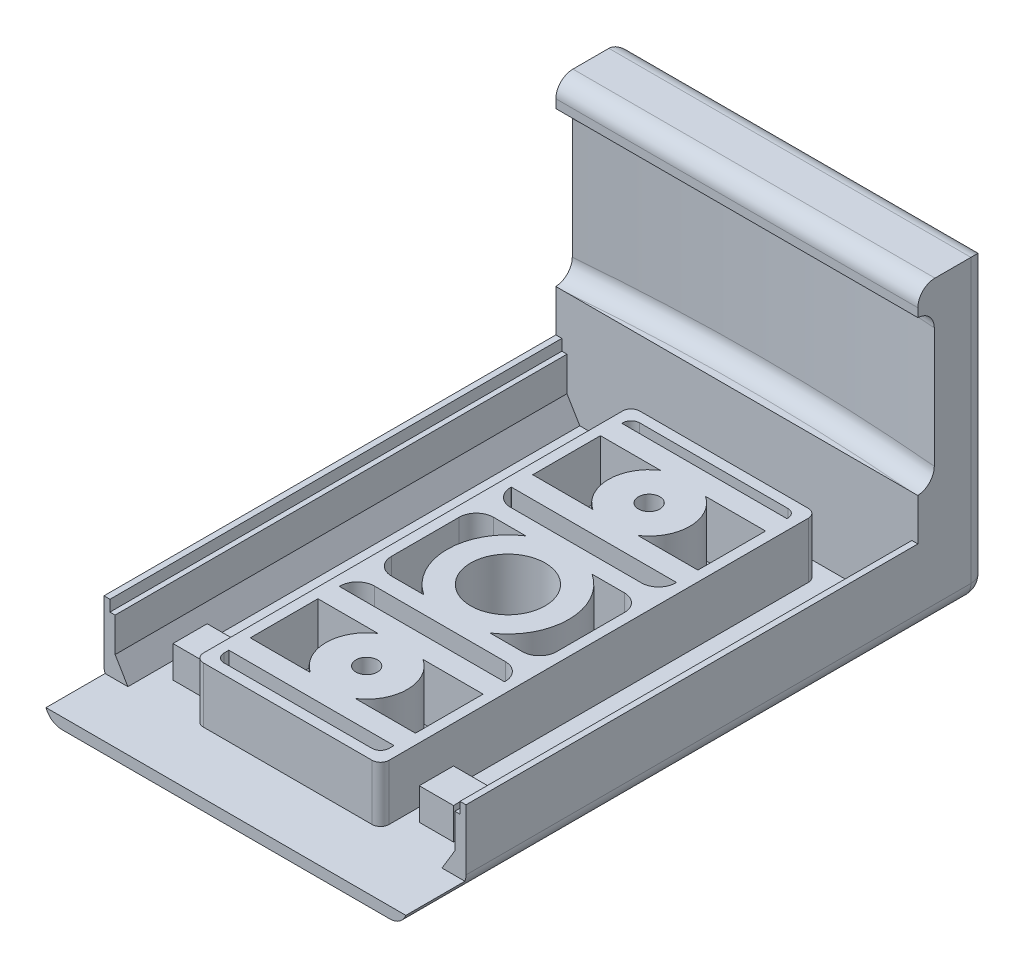
from build123d import *

# Parameters (mm, degrees)
SALIENTE_EXTRUIR1_DEPTH  = 42.3
CROQUIS3_W               = 40.9
CROQUIS3_H               = 56.9
CORTAR_EXTRUIR1_DEPTH    = 1.3
CROQUIS5_W               = 42.3
CROQUIS5_H               = 2.8
CORTAR_EXTRUIR2_DEPTH    = 7.8
CROQUIS6_W               = 40.9
CROQUIS6_H               = 26.5
CORTAR_EXTRUIR3_DEPTH    = 1.3
CROQUIS8_W               = 39.7
CROQUIS8_H               = 56.9
CORTAR_EXTRUIR4_DEPTH    = 6.5
CROQUIS9_W               = 39.7
CROQUIS9_H               = 32.2
CORTAR_EXTRUIR5_DEPTH    = 7.3
CROQUIS10_W              = 21.7
CROQUIS10_H              = 50.979199381
CROQUIS10_W_2            = 19.3
CROQUIS10_H_2            = 48.579199381
SALIENTE_EXTRUIR2_DEPTH  = 6.5
REDONDEO6_R              = 1
REDONDEO7_R              = 1
CROQUIS17_W              = 39.7
CROQUIS17_H              = 32.2
SALIENTE_EXTRUIR4_DEPTH  = 6
SALIENTE_EXTRUIR5_DEPTH  = 1.3
CORTAR_EXTRUIR6_DEPTH    = 21
REDONDEO8_R              = 2
REDONDEO10_R             = 2
CROQUIS26_R              = 7.1
CROQUIS26_R_2            = 4.35
SALIENTE_EXTRUIR7_DEPTH  = 6.5
CORTAR_EXTRUIR7_START    = -44
CROQUIS27_R              = 4.35
CORTAR_EXTRUIR7_DEPTH    = 44
CROQUIS28_W              = 19.3
CROQUIS28_H              = 2
SALIENTE_EXTRUIR8_DEPTH  = 6.5
REDONDEO11_R             = 2
REDONDEO12_R             = 2
CROQUIS30_R              = 4.75
CROQUIS30_R_2            = 1.25
SALIENTE_EXTRUIR9_DEPTH  = 6.5
CROQUIS33_W              = 19.3
CROQUIS33_H              = 2.5
SALIENTE_EXTRUIR11_DEPTH = 6.5
CORTAR_EXTRUIR8_DEPTH    = 4.1
CROQUIS23_W              = 4
CROQUIS23_H              = 4
SALIENTE_EXTRUIR12_DEPTH = 3.7
NERVIO5_REACH            = 61.555
CROQUIS39_WALL_W         = 124.026264302
CROQUIS39_WALL_H         = 52.8
NERVIO7_REACH            = 61.555
CROQUIS43_WALL_W         = 124.026264302
CROQUIS43_WALL_H         = 52.8
CROQUIS44_W              = 42.3
CROQUIS44_H              = 3
SALIENTE_EXTRUIR13_DEPTH = 4.7
REDONDEO13_R             = 2
REDONDEO14_R             = 2


with BuildPart() as part:
    # Croquis1 → Saliente-Extruir1 (new body)
    with BuildSketch(Plane(origin=(0, 0, 0), x_dir=(0, 0, -1), z_dir=(1, 0, 0))):
        Polygon((-38.13826087, -2.227336957), (21.56173913, -2.227336957), (21.56173913, 23.672663043), (29.76173913, 23.672663043), (29.76173913, -2.261684783), (29.76173913, -11.327336957), (-38.13826087, -11.327336957), align=None)
    extrude(amount=-SALIENTE_EXTRUIR1_DEPTH)

    # Croquis3 → Cortar-Extruir1 (cut)
    with BuildSketch(Plane(origin=(0, -2.227336957, 0), x_dir=(1, 0, 0), z_dir=(0, 1, 0))):
        with Locations((-21.15, -6.88826087)):
            Rectangle(CROQUIS3_W, CROQUIS3_H)
    extrude(amount=-CORTAR_EXTRUIR1_DEPTH, mode=Mode.SUBTRACT)

    # Croquis5 → Cortar-Extruir2 (cut)
    with BuildSketch(Plane(origin=(0, -2.227336957, 0), x_dir=(1, 0, 0), z_dir=(0, 1, 0))):
        with Locations((-21.15, -36.73826087)):
            Rectangle(CROQUIS5_W, CROQUIS5_H)
    extrude(amount=-CORTAR_EXTRUIR2_DEPTH, mode=Mode.SUBTRACT)

    # Croquis6 → Cortar-Extruir3 (cut)
    with BuildSketch(Plane.XY.offset(-21.56173913)):
        with Locations((-21.15, 9.722663043)):
            Rectangle(CROQUIS6_W, CROQUIS6_H)
    extrude(amount=-CORTAR_EXTRUIR3_DEPTH, mode=Mode.SUBTRACT)

    # Croquis8 → Cortar-Extruir4 (cut)
    with BuildSketch(Plane(origin=(0, -3.527336957, 0), x_dir=(1, 0, 0), z_dir=(0, 1, 0))):
        with Locations((-21.15, -6.88826087)):
            Rectangle(CROQUIS8_W, CROQUIS8_H)
    extrude(amount=-CORTAR_EXTRUIR4_DEPTH, mode=Mode.SUBTRACT)

    # Croquis9 → Cortar-Extruir5 (cut)
    with BuildSketch(Plane.XY.offset(-21.56173913)):
        with Locations((-21.15, 6.072663043)):
            Rectangle(CROQUIS9_W, CROQUIS9_H)
    extrude(amount=-CORTAR_EXTRUIR5_DEPTH, mode=Mode.SUBTRACT)

    # Croquis10 → Saliente-Extruir2 (add)
    with BuildSketch(Plane(origin=(0, -10.027336957, 0), x_dir=(1, 0, 0), z_dir=(0, 1, 0))):
        with Locations((-21.15, -5.42786056)):
            Rectangle(CROQUIS10_W, CROQUIS10_H)
        with Locations((-21.15, -5.427860561)):
            Rectangle(CROQUIS10_W_2, CROQUIS10_H_2, mode=Mode.SUBTRACT)
    extrude(amount=SALIENTE_EXTRUIR2_DEPTH)

    # Redondeo6
    redondeo6_edges = [part.edges().sort_by_distance(p)[0] for p in [
        (-30.8, -6.777336957, -18.86173913),
        (-11.5, -6.777336957, -18.86173913),
        (-11.5, -6.777336957, 29.717460251),
        (-30.8, -6.777336957, 29.717460251),
    ]]
    fillet(redondeo6_edges, radius=REDONDEO6_R)

    # Redondeo7
    redondeo7_edges = [part.edges().sort_by_distance(p)[0] for p in [
        (-10.3, -6.777336957, -20.06173913),
        (-10.3, -6.777336957, 30.917460251),
        (-32, -6.777336957, 30.917460251),
        (-32, -6.777336957, -20.06173913),
    ]]
    fillet(redondeo7_edges, radius=REDONDEO7_R)

    # Croquis17 → Saliente-Extruir4 (add)
    with BuildSketch(Plane.XY.offset(-28.86173913)):
        with Locations((-21.15, 6.072663043)):
            Rectangle(CROQUIS17_W, CROQUIS17_H)
    extrude(amount=SALIENTE_EXTRUIR4_DEPTH)

    # Croquis18 → Saliente-Extruir5 (add)
    with BuildSketch(Plane.XY.offset(-22.86173913)):
        Polygon((-41.6, 22.972663043), (-41.6, -3.527336957), (-41, -3.527336957), (-41, -10.027336957), (-1.3, -10.027336957), (-1.3, -3.527336957), (-0.7, -3.527336957), (-0.7, 22.972663043), align=None)
    extrude(amount=SALIENTE_EXTRUIR5_DEPTH)

    # Croquis19 → Cortar-Extruir6 (cut)
    with BuildSketch(Plane(origin=(0, 23.672663043, 0), x_dir=(1, 0, 0), z_dir=(0, 1, 0))):
        with BuildLine():
            Line((-42.3, 23.48173913), (-42.3, 21.56173913))
            Line((-42.3, 21.56173913), (0, 21.56173913))
            Line((0, 21.56173913), (0, 23.48173913))
            ThreePointArc((0, 23.48173913), (-21.15, 24.415477395), (-42.3, 23.48173913))
        make_face()
    extrude(amount=-CORTAR_EXTRUIR6_DEPTH, mode=Mode.SUBTRACT)

    # Redondeo8
    redondeo8_edges = [part.edges().sort_by_distance(p)[0] for p in [
        (-42.3, 6.172663043, -29.76173913),
        (-21.15, 23.672663043, -29.76173913),
        (-21.15, -11.327336957, -29.76173913),
        (0, 6.172663043, -29.76173913),
    ]]
    fillet(redondeo8_edges, radius=REDONDEO8_R)

    # Redondeo10
    # the kernel refuses this fillet: 2 mm, written as the material it takes off along each edge
    with BuildSketch(Plane(origin=(-40.3, -9.327336957, -27.76173913), x_dir=(-1, 0, 0), z_dir=(0, -1, 0))) as redondeo10_piece_1_section:
        Polygon((0, 0), (REDONDEO10_R, 0), (REDONDEO10_R, REDONDEO10_R), (0, REDONDEO10_R), align=None)
    redondeo10_piece_1 = extrude(amount=REDONDEO10_R, mode=Mode.PRIVATE)
    redondeo10_piece_1 = redondeo10_piece_1 - Plane(origin=(-40.3, -9.327336957, -27.76173913), x_dir=(0.7071067811865475, 0, 0.7071067811865475), z_dir=(0, -1, 0)) * Sphere(REDONDEO10_R, mode=Mode.PRIVATE)
    add(redondeo10_piece_1, mode=Mode.SUBTRACT)
    with BuildSketch(Plane(origin=(-2, -9.327336957, -27.76173913), x_dir=(0, -1, 0), z_dir=(1, 0, 0))) as redondeo10_piece_2_section:
        Polygon((0, 0), (REDONDEO10_R, 0), (REDONDEO10_R, REDONDEO10_R), (0, REDONDEO10_R), align=None)
    redondeo10_piece_2 = extrude(amount=REDONDEO10_R, mode=Mode.PRIVATE)
    redondeo10_piece_2 = redondeo10_piece_2 - Plane(origin=(-2, -9.327336957, -27.76173913), x_dir=(0, 0.7071067811865475, 0.7071067811865475), z_dir=(1, 0, 0)) * Sphere(REDONDEO10_R, mode=Mode.PRIVATE)
    add(redondeo10_piece_2, mode=Mode.SUBTRACT)
    with BuildSketch(Plane(origin=(-42.3, -11.327336957, -27.76173913), x_dir=(1, 0, 0), z_dir=(0, 0, 1)), Plane(origin=(0, -11.327336957, -27.76173913), x_dir=(0, 1, 0), z_dir=(0, 0, 1))) as redondeo10_piece_3:
        with BuildLine():
            CenterArc((REDONDEO10_R, REDONDEO10_R), REDONDEO10_R, 180, 90)
            Line((0, REDONDEO10_R), (0, 0))
            Line((0, 0), (REDONDEO10_R, 0))
        make_face()
    extrude(amount=70.9, mode=Mode.SUBTRACT)

    # Croquis26 → Saliente-Extruir7 (add)
    with BuildSketch(Plane(origin=(0, -10.027336957, 0), x_dir=(1, 0, 0), z_dir=(0, 1, 0))):
        with Locations(Location((-21.15, -5.18826087, 0), (0, 0, 90))):
            Circle(CROQUIS26_R)
        with Locations(Location((-21.15, -5.18826087, 0), (0, 0, 270))):
            Circle(CROQUIS26_R_2, mode=Mode.SUBTRACT)
    extrude(amount=SALIENTE_EXTRUIR7_DEPTH)

    # Croquis27 → Cortar-Extruir7 (cut)
    with BuildSketch(Plane(origin=(0, -10.027336957, 0), x_dir=(1, 0, 0), z_dir=(0, 1, 0)).offset(CORTAR_EXTRUIR7_START)):
        with Locations(Location((-21.15, -5.18826087, 0), (0, 0, 90))):
            Circle(CROQUIS27_R)
    extrude(amount=CORTAR_EXTRUIR7_DEPTH, mode=Mode.SUBTRACT)

    # Croquis28 → Saliente-Extruir8 (add)
    with BuildSketch(Plane(origin=(0, -10.027336957, 0), x_dir=(1, 0, 0), z_dir=(0, 1, 0))):
        with Locations((-21.15, 1.769114844)):
            Rectangle(CROQUIS28_W, CROQUIS28_H)
        with Locations((-21.15, -12.145636583)):
            Rectangle(CROQUIS28_W, CROQUIS28_H)
    extrude(amount=SALIENTE_EXTRUIR8_DEPTH)

    # Redondeo11
    redondeo11_edges = [part.edges().sort_by_distance(p)[0] for p in [
        (-30.8, -6.777336957, -0.769114844),
        (-11.5, -6.777336957, -0.769114844),
        (-11.5, -6.777336957, 11.145636583),
        (-30.8, -6.777336957, 11.145636583),
    ]]
    fillet(redondeo11_edges, radius=REDONDEO11_R)

    # Redondeo12
    redondeo12_edges = [part.edges().sort_by_distance(p)[0] for p in [
        (-30.8, -6.777336957, -2.769114844),
        (-11.5, -6.777336957, -2.769114844),
        (-30.8, -6.777336957, 13.145636583),
        (-11.5, -6.777336957, 13.145636583),
    ]]
    fillet(redondeo12_edges, radius=REDONDEO12_R)

    # Croquis30 → Saliente-Extruir9 (add)
    # profile 1 of 2: a face of its own
    with BuildSketch(Plane(origin=(0, -10.027336957, 0), x_dir=(1, 0, 0), z_dir=(0, 1, 0))):
        with Locations(Location((-21.15, 11.315426987, 0), (0, 0, 90))):
            Circle(CROQUIS30_R)
        with Locations(Location((-21.15, 11.315426987, 0), (0, 0, 270))):
            Circle(CROQUIS30_R_2, mode=Mode.SUBTRACT)
    # profile 2 of 2: a face of its own
    with BuildSketch(Plane(origin=(0, -10.027336957, 0), x_dir=(1, 0, 0), z_dir=(0, 1, 0))):
        with Locations(Location((-21.15, -21.691948726, 0), (0, 0, 90))):
            Circle(CROQUIS30_R)
        with Locations(Location((-21.15, -21.691948726, 0), (0, 0, 90))):
            Circle(CROQUIS30_R_2, mode=Mode.SUBTRACT)
    extrude(amount=SALIENTE_EXTRUIR9_DEPTH)

    # Croquis33 → Saliente-Extruir11 (add)
    with BuildSketch(Plane(origin=(0, -10.027336957, 0), x_dir=(1, 0, 0), z_dir=(0, 1, 0))):
        with Locations((-21.15, 16.519944868)):
            Rectangle(CROQUIS33_W, CROQUIS33_H)
        with Locations((-21.15, 6.110909106)):
            Rectangle(CROQUIS33_W, CROQUIS33_H)
        with Locations((-21.15, -16.487430845)):
            Rectangle(CROQUIS33_W, CROQUIS33_H)
        with Locations((-21.15, -26.896466607)):
            Rectangle(CROQUIS33_W, CROQUIS33_H)
    extrude(amount=SALIENTE_EXTRUIR11_DEPTH)

    # Croquis34 → Cortar-Extruir8 (cut)
    with BuildSketch(Plane.XY.offset(35.33826087)):
        Polygon((-1.3, -10.027336957), (-1.3, -3.527336957), (-0.7, -3.527336957), (-0.7, -2.227336957), (0, -2.227336957), (0, -10.027336957), align=None)
        Polygon((-42.3, -2.227336957), (-42.3, -10.027336957), (-41, -10.027336957), (-41, -3.527336957), (-41.6, -3.527336957), (-41.6, -2.227336957), align=None)
    extrude(amount=-CORTAR_EXTRUIR8_DEPTH, mode=Mode.SUBTRACT)

    # Croquis23 → Saliente-Extruir12 (add)
    with BuildSketch(Plane(origin=(0, -10.027336957, 0), x_dir=(1, 0, 0), z_dir=(0, 1, 0))):
        with Locations((-6.76, -25.93826087)):
            Rectangle(CROQUIS23_W, CROQUIS23_H)
        with Locations((-35.54, -25.93826087)):
            Rectangle(CROQUIS23_W, CROQUIS23_H)
    extrude(amount=SALIENTE_EXTRUIR12_DEPTH)

    # Croquis39 wall → Nervio5 (add, up to next)
    with BuildSketch(Plane(origin=(-40.25, -8.777336957, 4.83826087), x_dir=(0.514495755428, -0.857492925713, 0), z_dir=(0.857492925713, 0.514495755428, 0)), mode=Mode.PRIVATE) as nervio5_sk1:
        Rectangle(CROQUIS39_WALL_W, CROQUIS39_WALL_H)
    nervio5_tool1 = extrude(nervio5_sk1.sketch, amount=-NERVIO5_REACH, mode=Mode.PRIVATE) - part.part
    add(nervio5_tool1.solids().sort_by_distance((-40.25, -8.777336957, 4.83826087))[0])

    # Croquis43 wall → Nervio7 (add, up to next)
    with BuildSketch(Plane(origin=(-2.05, -8.777336957, 4.83826087), x_dir=(-0.514495755428, -0.857492925713, 0), z_dir=(0.857492925713, -0.514495755428, 0)), mode=Mode.PRIVATE) as nervio7_sk1:
        Rectangle(CROQUIS43_WALL_W, CROQUIS43_WALL_H)
    nervio7_tool1 = extrude(nervio7_sk1.sketch, amount=NERVIO7_REACH, mode=Mode.PRIVATE) - part.part
    add(nervio7_tool1.solids().sort_by_distance((-2.05, -8.777336957, 4.83826087))[0])

    # Croquis44 → Saliente-Extruir13 (add)
    with BuildSketch(Plane.XY.offset(-21.56173913)):
        with Locations((-21.15, 22.172663043)):
            Rectangle(CROQUIS44_W, CROQUIS44_H)
    extrude(amount=-SALIENTE_EXTRUIR13_DEPTH)

    # Redondeo13
    redondeo13_edges = [part.edges().sort_by_distance(p)[0] for p in [
        (-21.15, 2.672663043, -24.415477395),
        (-21.15, 20.672663043, -24.415477395),
    ]]
    fillet(redondeo13_edges, radius=REDONDEO13_R)

    # Redondeo14
    redondeo14_edges = [part.edges().sort_by_distance(p)[0] for p in [
        (-21.15, 23.672663043, -21.56173913),
    ]]
    fillet(redondeo14_edges, radius=REDONDEO14_R)


solid = part.part
